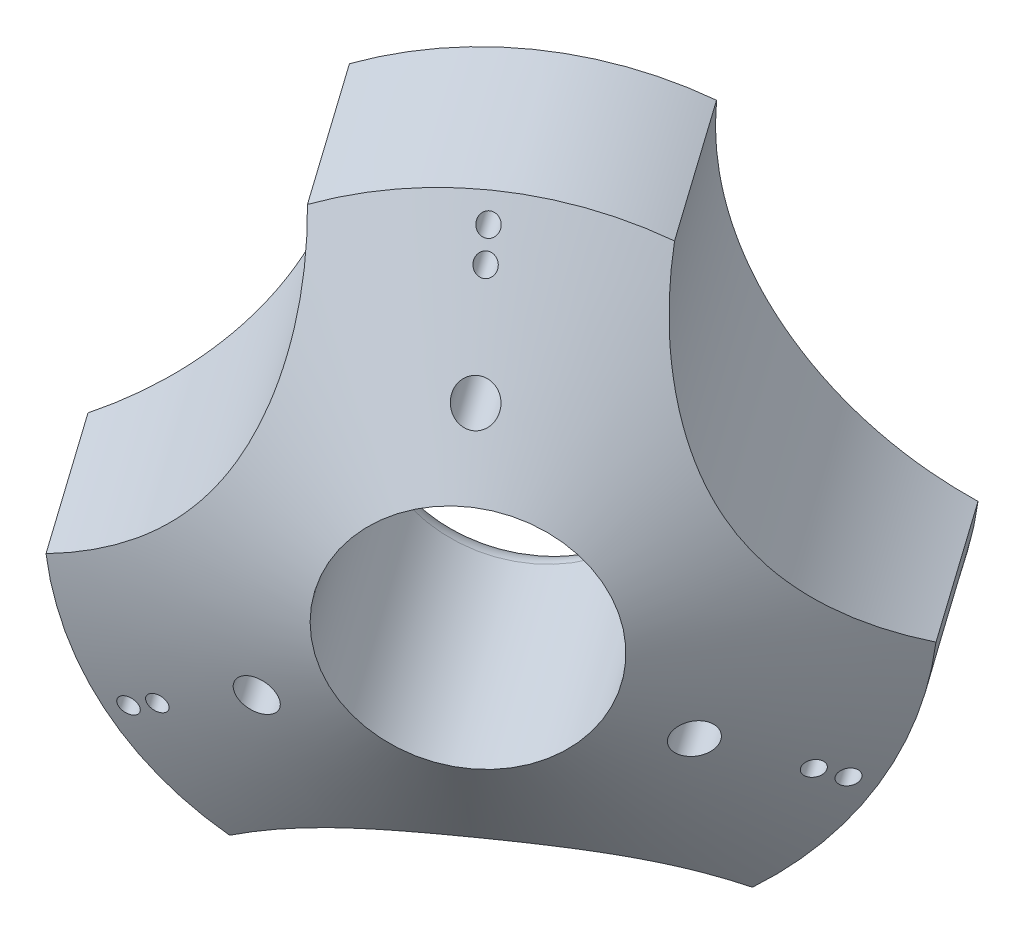
from build123d import *

# Parameters (mm, degrees)
SKETCH_2_R          = 1
SKETCH_2_R_2        = 2
SKETCH_2_R_3        = 36.25
SKETCH_2_R_4        = 12.5
CUT_EXTRUDE_1_DEPTH = 45
FILLET_1_R          = 3.5
SHELL_1_T           = 2


with BuildPart() as part:
    # 草图1 → 旋转1 (revolve)
    with BuildSketch(Plane(origin=(0, 0, 0), x_dir=(1, 0, 0), z_dir=(0, 1, 0))):
        Polygon((-19.213449962, -33.278671522), (-30.342636684, -17.518329456), (-52.434282873, -30.272947329), (-33.202316372, -57.508098885), align=None)
    revolve(axis=Axis((-61.130709116, 0, 35.293831361), (0.5768263938081878, 0, 0.8168667647825082)))

    # 草图2 → 切除-拉伸1 (cut)
    with BuildSketch(Plane(origin=(-3.182070737, 0, -4.506256745), x_dir=(-0.816866764782508, 0, 0.576826393808188), z_dir=(-0.576826393808188, 0, -0.816866764782508))):
        with Locations((70.294058052, 30)):
            Circle(SKETCH_2_R)
        with Locations((70.294058052, 20)):
            Circle(SKETCH_2_R_2)
        with Locations((70.294058052, 32.903131783)):
            Circle(SKETCH_2_R)
        with Locations((19.643416175, 29.243161723)):
            Circle(SKETCH_2_R_3)
        with Locations((120.94469993, 29.243161723)):
            Circle(SKETCH_2_R_3)
        with Locations((98.789006041, -16.451565892)):
            Circle(SKETCH_2_R)
        with Locations((96.274820166, -15)):
            Circle(SKETCH_2_R)
        with Locations((87.614566128, -10)):
            Circle(SKETCH_2_R_2)
        with Locations((70.294058052, -58.486323445)):
            Circle(SKETCH_2_R_3)
        with Locations((41.799110064, -16.451565892)):
            Circle(SKETCH_2_R)
        with Locations((44.313295939, -15)):
            Circle(SKETCH_2_R)
        with Locations((52.973549977, -10)):
            Circle(SKETCH_2_R_2)
        with Locations((70.294058052, 0)):
            Circle(SKETCH_2_R_4)
    extrude(amount=-CUT_EXTRUDE_1_DEPTH, mode=Mode.SUBTRACT)

    # 圆角1
    fillet_1_edges = [part.edges().sort_by_distance(p)[0] for p in [
        (-60.471010872, -12.5, 36.228056244),
    ]]
    fillet(fillet_1_edges, radius=FILLET_1_R)

    # 抽壳1 (no face opened: a closed hollow body)
    add(offset(amount=-SHELL_1_T, mode=Mode.PRIVATE), mode=Mode.SUBTRACT)


solid = part.part
